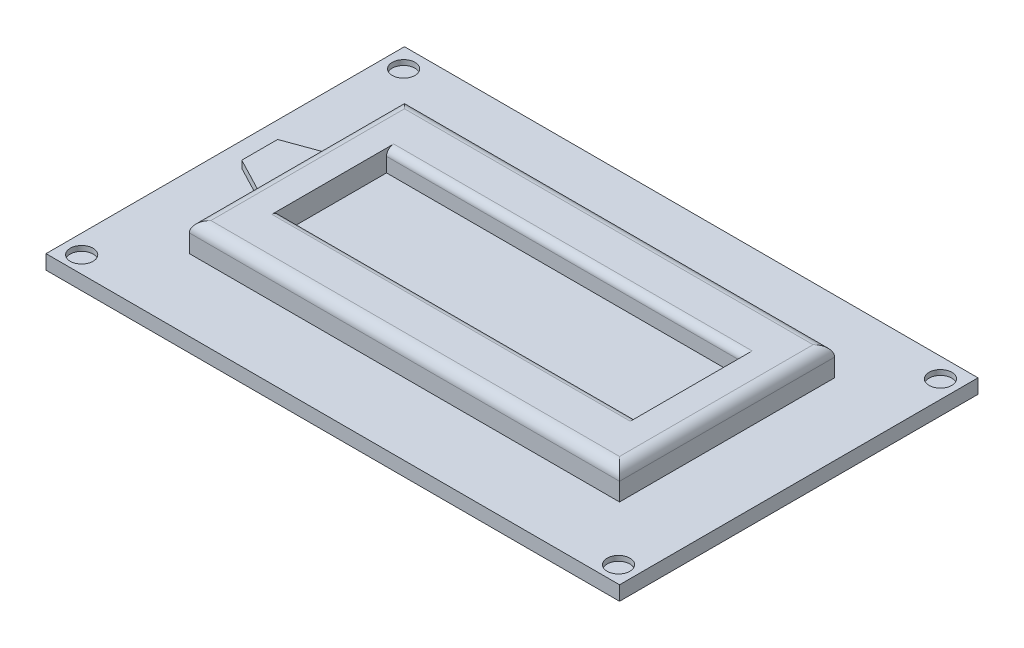
from build123d import *

# Parameters (mm, degrees)
SKETCH1_W               = 80
SKETCH1_H               = 50
BOSS_EXTRUDE1_DEPTH     = 2
SKETCH2_W               = 60
SKETCH2_H               = 30
SKETCH2_W_2             = 50
SKETCH2_H_2             = 15
BOSS_EXTRUDE4_DEPTH     = 4
SKETCH3_W               = 50
SKETCH3_H               = 15
BOSS_EXTRUDE5_DEPTH     = 1
BOSS_EXTRUDE6_DEPTH     = 1
FILLET2_R               = 1
FILLET3_R               = 1.5
ADVANCEDHOLE1_START     = 1.2888
ADVANCEDHOLE1_OUTLINE_R = 1.5875
ADVANCEDHOLE1_DEPTH     = 0.7112


# Read off the part's stored shape, not the designer's step: AdvancedHole1
with BuildPart() as part:
    # Sketch1 → Boss-Extrude1 (new body)
    with BuildSketch(Plane(origin=(0, 0, 0), x_dir=(1, 0, 0), z_dir=(0, 1, 0))):
        with Locations((-17.763975155, -4.037267081)):
            Rectangle(SKETCH1_W, SKETCH1_H)
    extrude(amount=BOSS_EXTRUDE1_DEPTH)

    # Sketch2 → Boss-Extrude4 (add)
    with BuildSketch(Plane(origin=(0, 2, 0), x_dir=(1, 0, 0), z_dir=(0, 1, 0))):
        with Locations((-17.763975155, -4.037267081)):
            Rectangle(SKETCH2_W, SKETCH2_H)
        with Locations((-17.763975155, -4.037267081)):
            Rectangle(SKETCH2_W_2, SKETCH2_H_2, mode=Mode.SUBTRACT)
    extrude(amount=BOSS_EXTRUDE4_DEPTH)

    # Sketch3 → Boss-Extrude5 (add)
    with BuildSketch(Plane(origin=(0, 2, 0), x_dir=(1, 0, 0), z_dir=(0, 1, 0))):
        with Locations((-17.763975155, -4.037267081)):
            Rectangle(SKETCH3_W, SKETCH3_H)
    extrude(amount=BOSS_EXTRUDE5_DEPTH)

    # Sketch4 → Boss-Extrude6 (add)
    with BuildSketch(Plane(origin=(0, 3, 0), x_dir=(1, 0, 0), z_dir=(0, 1, 0))):
        Polygon((-47.763975155, 0.962732919), (-47.763975155, -9.037267081), (-53.40213088, -6.089387941), (-53.40213088, -1.089387941), align=None)
    extrude(amount=BOSS_EXTRUDE6_DEPTH)

    # Fillet2
    fillet2_edges = [part.edges().sort_by_distance(p)[0] for p in [
        (-17.763975155, 6, 11.537267081),
        (-17.763975155, 6, -3.462732919),
    ]]
    fillet(fillet2_edges, radius=FILLET2_R)

    # Fillet3
    fillet3_edges = [part.edges().sort_by_distance(p)[0] for p in [
        (-47.763975155, 6, 4.037267081),
        (-17.763975155, 6, 19.037267081),
        (12.236024845, 6, 4.037267081),
        (-17.763975155, 6, -10.962732919),
    ]]
    fillet(fillet3_edges, radius=FILLET3_R)

    # AdvancedHole1 outline → AdvancedHole1 (cut)
    with BuildSketch(Plane(origin=(0, 0, 0), x_dir=(1, 0, 0), z_dir=(0, 1, 0)).offset(ADVANCEDHOLE1_START)):
        with Locations((19.741560812, -26.683343296)):
            Circle(ADVANCEDHOLE1_OUTLINE_R)
        with Locations((-55.139734181, -26.683343296)):
            Circle(ADVANCEDHOLE1_OUTLINE_R)
        with Locations((19.741560812, 18.219478311)):
            Circle(ADVANCEDHOLE1_OUTLINE_R)
        with Locations((-55.139734181, 18.219478311)):
            Circle(ADVANCEDHOLE1_OUTLINE_R)
    extrude(amount=ADVANCEDHOLE1_DEPTH, mode=Mode.SUBTRACT)


solid = part.part
